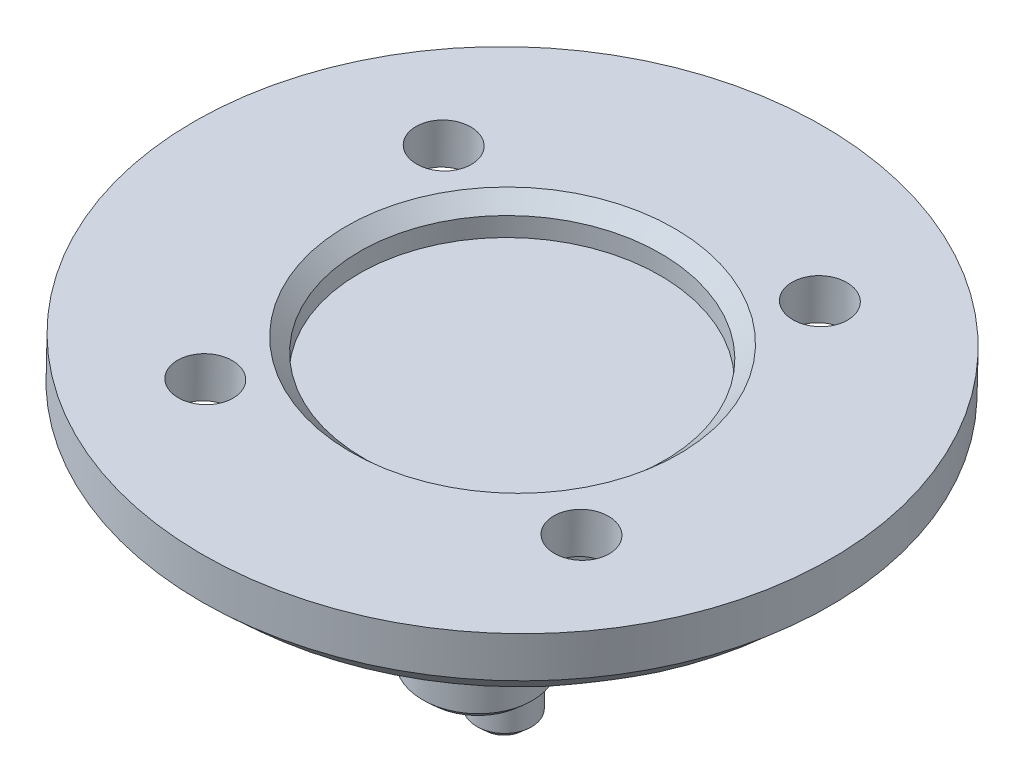
from build123d import *

# Parameters (mm, degrees)
SKETCH_1_R          = 11.5
SKETCH_1_R_2        = 5.5
SKETCH_1_R_3        = 1
EXTRUDE_1_DEPTH     = 2.5
EXTRUDE_START       = -1.3
SKETCH_2_R          = 5.5
EXTRUDE_2_DEPTH     = 1.3
SKETCH_5_R          = 2.5
CUT_EXTRUDE_1_DEPTH = 1
SKETCH_6_R          = 2
EXTRUDE_3_DEPTH     = 7.5
SKETCH_7_R          = 3
EXTRUDE_4_DEPTH     = 4
SKETCH_10_R         = 1
EXTRUDE_5_DEPTH     = 2
CHAMFER_1_SIZE      = 0.3
SKETCH_11_R         = 2.300425052
EXTRUDE_6_DEPTH     = 1.5
CHAMFER_2_SIZE      = 1
CHAMFER_3_SIZE      = 0.5
CHAMFER_4_SIZE      = 0.5


with BuildPart() as part:
    # 草图1 → 凸台-拉伸1 (new body)
    with BuildSketch(Plane(origin=(1.966710395, 32.715392416, 1.10826425), x_dir=(0.9981999912017503, -0.059938758009620605, -0.002030480999629514), z_dir=(-0.05997314036154614, -0.9976277272985652, -0.03379556421002548))):
        with Locations(Location((-129.040965006, -30.648001563, 0), (0, 0, 0.116404566))):
            Circle(SKETCH_1_R)
        with Locations(Location((-129.040965006, -30.648001563, 0), (0, 0, 0.116404566))):
            Circle(SKETCH_1_R_2, mode=Mode.SUBTRACT)
        with Locations(Location((-135.609495823, -34.813863168, 0), (0, 0, 0.116404566))):
            Circle(SKETCH_1_R_3, mode=Mode.SUBTRACT)
        with Locations(Location((-133.206826611, -24.079470746, 0), (0, 0, 0.116404566))):
            Circle(SKETCH_1_R_3, mode=Mode.SUBTRACT)
        with Locations(Location((-122.472434189, -26.482139959, 0), (0, 0, 0.116404566))):
            Circle(SKETCH_1_R_3, mode=Mode.SUBTRACT)
        with Locations(Location((-124.875103402, -37.21653238, 0), (0, 0, 0.116404566))):
            Circle(SKETCH_1_R_3, mode=Mode.SUBTRACT)
    extrude(amount=EXTRUDE_1_DEPTH)

    # 草图2 → 凸台-拉伸2 (add)
    with BuildSketch(Plane(origin=(1.816777544, 30.221323097, 1.02377534), x_dir=(0.9981999912017503, -0.059938758009620605, -0.002030480999629515), z_dir=(-0.05997314036154614, -0.9976277272985652, -0.03379556421002549)).offset(EXTRUDE_START)):
        with Locations(Location((-129.040965006, -30.648001563, 0), (0, 0, 0.116404566))):
            Circle(SKETCH_2_R)
    extrude(amount=EXTRUDE_2_DEPTH)

    # 草图5 → 切除-拉伸1 (cut)
    with BuildSketch(Plane(origin=(1.816777544, 30.221323097, 1.02377534), x_dir=(0.9981999912017503, -0.059938758009620605, -0.002030480999629515), z_dir=(-0.05997314036154614, -0.9976277272985652, -0.03379556421002564))):
        with Locations(Location((-135.609495823, -34.813863168, 0), (0, 0, 0.116404566))):
            Circle(SKETCH_5_R)
        with Locations(Location((-133.206826611, -24.079470746, 0), (0, 0, 0.116404566))):
            Circle(SKETCH_5_R)
        with Locations(Location((-122.472434189, -26.482139959, 0), (0, 0, 0.116404566))):
            Circle(SKETCH_5_R)
        with Locations(Location((-124.875103402, -37.21653238, 0), (0, 0, 0.116404566))):
            Circle(SKETCH_5_R)
    extrude(amount=-CUT_EXTRUDE_1_DEPTH, mode=Mode.SUBTRACT)

    # 草图6 → 凸台-拉伸3 (add)
    with BuildSketch(Plane(origin=(1.816777544, 30.221323097, 1.02377534), x_dir=(0.9981999912017503, -0.059938758009620605, -0.002030480999629515), z_dir=(-0.05997314036154614, -0.9976277272985652, -0.033795564210025573))):
        with Locations(Location((-129.040965006, -29.648001563, 0), (0, 0, 180.116404566))):
            Circle(SKETCH_6_R)
    extrude(amount=EXTRUDE_3_DEPTH)

    # 草图7 → 凸台-拉伸4 (add)
    with BuildSketch(Plane(origin=(1.816777544, 30.221323097, 1.02377534), x_dir=(0.9981999912017503, -0.059938758009620605, -0.002030480999629515), z_dir=(-0.05997314036154614, -0.9976277272985652, -0.033795564210025615))):
        with Locations(Location((-129.040965006, -29.648001563, 0), (0, 0, 0.116404566))):
            Circle(SKETCH_7_R)
    extrude(amount=EXTRUDE_4_DEPTH)

    # 草图10 → 凸台-拉伸5 (add)
    with BuildSketch(Plane(origin=(1.366978991, 22.739115143, 0.770308608), x_dir=(0.9981999912017503, -0.05993875800962059, -0.002030480999629514), z_dir=(-0.05997314036154613, -0.9976277272985652, -0.03379556421002559))):
        with Locations(Location((-129.040965006, -30.648001563, 0), (0, 0, 269.999999999))):
            Circle(SKETCH_10_R)
    extrude(amount=EXTRUDE_5_DEPTH)

    # 倒角1
    # the kernel refuses this chamfer: 0.3 mm, written as the material it takes off along each edge
    with BuildSketch(Plane(origin=(-127.441711143, 31.477448067, -28.598680652), x_dir=(-1.5916157281026276e-11, 0.0338565062200545, -0.9994267041592252), z_dir=(-0.9981999912017503, 0.059938758009080766, 0.002030481015565288))) as chamfer_1_piece_1_section:
        Polygon((2, -CHAMFER_1_SIZE), (2 - CHAMFER_1_SIZE, 0), (2, 0), align=None)
    chamfer_1_piece_1 = revolve(axis=Axis((-127.441711143, 31.477448067, -28.598680652), (-0.05997314036154614, -0.9976277272985652, -0.03379556421002558)), revolution_arc=270.116404567, mode=Mode.PRIVATE)
    chamfer_1_piece_1 = chamfer_1_piece_1 - Plane(origin=(-127.43302189, 31.655846599, -29.593210861), x_dir=(-1.742146691663825e-11, 0.03385650622014407, -0.9994267041592222), z_dir=(0.05997314036154613, 0.9976277272985653, 0.033795564210025594)) * Cylinder(1, 8, mode=Mode.PRIVATE)
    add(chamfer_1_piece_1, mode=Mode.SUBTRACT)
    with BuildSketch(Plane(origin=(-127.231805152, 34.969145112, -28.480396177), x_dir=(0.9981979311307728, -0.060007418593410425, 2.631376598098256e-12), z_dir=(0.0020279845707766217, 0.033734662275686965, -0.9994287667661592))) as chamfer_1_piece_2:
        Polygon((3, -CHAMFER_1_SIZE), (3 - CHAMFER_1_SIZE, 0), (3, 0), align=None)
    revolve(axis=Axis((-127.231805152, 34.969145112, -28.480396177), (-0.05997314036154614, -0.9976277272985652, -0.03379556421002563)), mode=Mode.SUBTRACT)
    with BuildSketch(Plane(origin=(-127.561657424, 29.516049118, -29.665698484), x_dir=(-1.7422507880890286e-11, 0.03385650622014249, -0.9994267041592222), z_dir=(-0.9981999912017504, 0.05993875800902966, 0.0020304810170733417))) as chamfer_1_piece_3:
        Polygon((1, -CHAMFER_1_SIZE), (1 - CHAMFER_1_SIZE, 0), (1, 0), align=None)
    revolve(axis=Axis((-127.561657424, 29.516049118, -29.665698484), (-0.05997314036154613, -0.9976277272985653, -0.033795564210025594)), mode=Mode.SUBTRACT)
    with BuildSketch(Plane(origin=(-127.441711143, 31.477448067, -28.598680652), x_dir=(-0.9981979311307727, 0.060007418593412805, -2.629008122312364e-12), z_dir=(-0.0020279845707743367, -0.03373466227568705, 0.9994287667661592))) as chamfer_1_piece_4_section:
        Polygon((2, -CHAMFER_1_SIZE), (2 - CHAMFER_1_SIZE, 0), (2, 0), align=None)
    chamfer_1_piece_4 = revolve(axis=Axis((-127.441711143, 31.477448067, -28.598680652), (-0.05997314036154614, -0.9976277272985652, -0.03379556421002558)), revolution_arc=89.883595433, mode=Mode.PRIVATE)
    chamfer_1_piece_4 = chamfer_1_piece_4 - Plane(origin=(-127.432917992, 31.657574909, -29.593152313), x_dir=(-1.742146691663825e-11, 0.03385650622014407, -0.9994267041592222), z_dir=(0.05997314036154613, 0.9976277272985653, 0.033795564210025594)) * Cylinder(1, 9, mode=Mode.PRIVATE)
    add(chamfer_1_piece_4, mode=Mode.SUBTRACT)

    # 草图11 → 凸台-拉伸6 (add)
    with BuildSketch(Plane(origin=(1.576884982, 26.230812188, 0.888593083), x_dir=(0.9981999912017503, -0.059938758009620605, -0.0020304809996295197), z_dir=(-0.05997314036154614, -0.9976277272985652, -0.03379556421002562))):
        with Locations(Location((-129.040965006, -29.648001563, 0), (0, 0, 180.116404566))):
            Circle(SKETCH_11_R)
    extrude(amount=EXTRUDE_6_DEPTH)

    # 倒角2
    chamfer_2_edges = [part.edges().sort_by_distance(p)[0] for p in [
        (-138.471188798, 39.683597842, -29.344640624),
    ]]
    chamfer(chamfer_2_edges, length=CHAMFER_2_SIZE)

    # 倒角3
    # the kernel refuses this chamfer: 0.5 mm, written as the material it takes off along each edge
    with BuildSketch(Plane(origin=(-122.833549573, 38.966203462, -35.917864433), x_dir=(0.9981979311307727, -0.06000741859341191, 2.6318502932554117e-12), z_dir=(0.0020279845707771465, 0.03373466227568696, -0.9994287667661592))) as chamfer_3_piece_1:
        Polygon((2.5 + CHAMFER_3_SIZE, 0), (2.5, -CHAMFER_3_SIZE), (2.5, 0), align=None)
    revolve(axis=Axis((-122.833549573, 38.966203462, -35.917864433), (-0.05997314036154614, -0.9976277272985652, -0.03379556421002566)), mode=Mode.SUBTRACT)
    with BuildSketch(Plane(origin=(-120.435205187, 38.458761429, -25.194504568), x_dir=(0.9981979311307725, -0.06000741859341508, 2.6304292077839058e-12), z_dir=(0.002027984570775836, 0.033734662275687034, -0.9994287667661591))) as chamfer_3_piece_2:
        Polygon((2.5 + CHAMFER_3_SIZE, 0), (2.5, -CHAMFER_3_SIZE), (2.5, 0), align=None)
    revolve(axis=Axis((-120.435205187, 38.458761429, -25.194504568), (-0.05997314036154614, -0.9976277272985652, -0.03379556421002566)), mode=Mode.SUBTRACT)
    with BuildSketch(Plane(origin=(-131.150275607, 39.020821594, -22.771416816), x_dir=(0.9981979311307727, -0.06000741859341225, 2.633271378726947e-12), z_dir=(0.0020279845707785755, 0.033734662275686875, -0.9994287667661592))) as chamfer_3_piece_3:
        Polygon((2.5 + CHAMFER_3_SIZE, 0), (2.5, -CHAMFER_3_SIZE), (2.5, 0), align=None)
    revolve(axis=Axis((-131.150275607, 39.020821594, -22.771416816), (-0.05997314036154614, -0.9976277272985652, -0.03379556421002566)), mode=Mode.SUBTRACT)
    with BuildSketch(Plane(origin=(-133.548619994, 39.528263626, -33.494776681), x_dir=(0.9981979311307727, -0.06000741859341225, 2.6318502932554267e-12), z_dir=(0.0020279845707771578, 0.03373466227568696, -0.9994287667661592))) as chamfer_3_piece_4:
        Polygon((2.5 + CHAMFER_3_SIZE, 0), (2.5, -CHAMFER_3_SIZE), (2.5, 0), align=None)
    revolve(axis=Axis((-133.548619994, 39.528263626, -33.494776681), (-0.05997314036154614, -0.9976277272985652, -0.03379556421002566)), mode=Mode.SUBTRACT)

    # 倒角4
    chamfer_4_edges = [part.edges().sort_by_distance(p)[0] for p in [
        (-132.33206836, 41.817622648, -29.260151714),
    ]]
    chamfer(chamfer_4_edges, length=CHAMFER_4_SIZE)


solid = part.part
